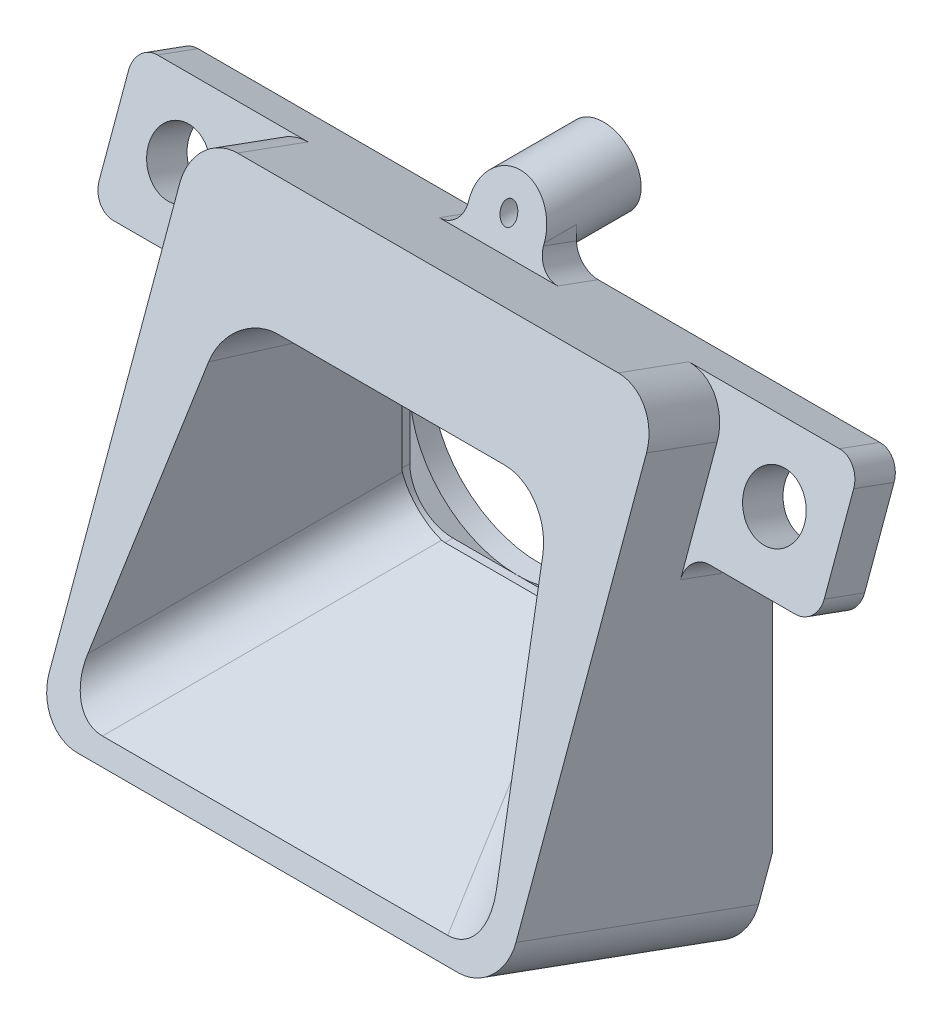
from build123d import *

# Parameters (mm, degrees)
BOSS_EXTRUDE1_DEPTH   = 12.6
SKETCH2_R             = 5.0000000000000036
CUT_EXTRUDE1_DEPTH    = 48.150424176246815
SKETCH3_W             = 10.00000000000001
SKETCH3_H             = 10.000000000000007
CUT_EXTRUDE2_DEPTH    = 11.6
CHAMFER1_SIZE         = 5
CHAMFER1_SIZE2        = 11.230183869521158
CUT_EXTRUDE3_DEPTH    = 48.150424176246815
BOSS_EXTRUDE2_DEPTH   = 40
SKETCH6_R             = 1.7500000000000004
SKETCH6_R_2           = 1.7500000000000002
BOSS_EXTRUDE3_DEPTH   = 3
CUT_EXTRUDE4_DEPTH    = 48.369406002186686
CUT_EXTRUDE5_DEPTH    = 47.07236166447865
BOSS_EXTRUDE4_DEPTH   = 6
SKETCH12_R            = 1.4000000000000001
CUT_EXTRUDE6_DEPTH    = 38.90502227131958
BOSS_EXTRUDE5_REACH   = 44.93
SKETCH14_W            = 3.5000000000000036
SKETCH14_H            = 3.265431857231029
CUT_EXTRUDE7_REACH    = 46.879
CUT_EXTRUDE8_REACH    = 46.879
M2_TAPPED_HOLE1_D     = 1.6
M2_TAPPED_HOLE1_DEPTH = 4.2
M2_TAPPED_HOLE1_TIP   = 0.48068849522204826
FILLET1_R             = 1
FILLET2_R             = 2
FILLET4_R             = 2


with BuildPart() as part:
    # Sketch1 → Boss-Extrude1 (new body)
    with BuildSketch(Plane.XY):
        Polygon((0, 0), (40, 0), (39.99999999999999, 21.550000000000004), (0, 21.550000000000004), align=None)
    extrude(amount=BOSS_EXTRUDE1_DEPTH)

    # Sketch2 → Cut-Extrude1 (cut, through all)
    with BuildSketch(Plane.XY.offset(12.6)):
        with Locations((19.999999999999996, 10.775000000000004)):
            Circle(SKETCH2_R)
    extrude(amount=-CUT_EXTRUDE1_DEPTH, mode=Mode.SUBTRACT)

    # Sketch3 → Cut-Extrude2 (cut)
    with BuildSketch(Plane.XY.offset(12.6)):
        with Locations((20, 10.775000000000002)):
            Rectangle(SKETCH3_W, SKETCH3_H)
    extrude(amount=-CUT_EXTRUDE2_DEPTH, mode=Mode.SUBTRACT)

    # Chamfer1
    chamfer1_edges = [part.edges().sort_by_distance(p)[0] for p in [
        (14.999999999999993, 10.775000000000002, 12.6),
        (19.999999999999996, 5.7749999999999995, 12.6),
        (25, 10.775000000000004, 12.6),
    ]]
    chamfer1_side = [part.faces().sort_by_distance(p)[0] for p in [
        (20, 0.45435696319083746, 12.6),
    ]]
    chamfer(chamfer1_edges, length=CHAMFER1_SIZE, length2=CHAMFER1_SIZE2, reference=chamfer1_side[0])

    # Sketch4 → Cut-Extrude3 (cut, through all)
    with BuildSketch(Plane.ZY):
        Polygon((12.6, 0), (5.164224911806891, 20.42962415095372), (0, 18.550000000000004), (0, 21.550000000000004), (12.6, 21.550000000000004), align=None)
    extrude(amount=-CUT_EXTRUDE3_DEPTH, mode=Mode.SUBTRACT)

    # Sketch5 → Boss-Extrude2 (add)
    with BuildSketch(Plane.ZY):
        Polygon((12.6, 0), (0, -4.5860249517541645), (0, 0), align=None)
    extrude(amount=-BOSS_EXTRUDE2_DEPTH)

    # Sketch6 → Boss-Extrude3 (add)
    with BuildSketch(Plane.XY.offset(-2.9999999999999996)):
        with Locations(Location((19.999999999999996, 20.275000000000002, 0), (0, 0, 260.303678946))):
            Circle(SKETCH6_R)
        with Locations(Location((20, 1.275000000000002, 0), (0, 0, 180))):
            Circle(SKETCH6_R_2)
    extrude(amount=BOSS_EXTRUDE3_DEPTH)

    # Sketch7 → Cut-Extrude4 (cut, through all)
    with BuildSketch(Plane(origin=(40, 1.288e-14, 0), x_dir=(0, 0, -1), z_dir=(1, 3.2e-16, 0))):
        Polygon((0, -4.586024951754178), (0, -0.47500000000000464), (-1.3212579510498954, -4.105126385784462), align=None)
    extrude(amount=-CUT_EXTRUDE4_DEPTH, mode=Mode.SUBTRACT)

    # Sketch8 → Cut-Extrude5 (cut, through all)
    with BuildSketch(Plane(origin=(0, 4.049561941025207, 11.126079991649561), x_dir=(1, 0, 0), z_dir=(0, 0.34202014332566943, 0.9396926207859082))):
        Polygon((0, 17.4312981155786), (9.149876173671583, 17.4312981155786), (9.149876173671586, -4.309453805903435), (0, -4.309453805903436), align=None)
        Polygon((40, -4.309453805903436), (30.850123826328417, -4.309453805903435), (30.850123826328417, 17.4312981155786), (40, 17.4312981155786), align=None)
    extrude(amount=-CUT_EXTRUDE5_DEPTH, mode=Mode.SUBTRACT)

    # Sketch11 → Boss-Extrude4 (add)
    with BuildSketch(Plane.ZY.offset(-9.149876173671585)):
        Polygon((4.8e-16, 18.550000000000008), (1.879385241571817, 19.234040286651346), (3.9315061015258332, 13.595884561935897), (2.0521208599540164, 12.911844275284558), align=None)
    boss_extrude4 = extrude(amount=BOSS_EXTRUDE4_DEPTH)

    # Sketch12 → Cut-Extrude6 (cut, through all)
    with BuildSketch(Plane(origin=(0, 2.8539780767228278, 7.841240321414484), x_dir=(1, 0, 0), z_dir=(0, 0.3420201433256694, 0.9396926207859083))):
        with Locations(Location((6.149876173671584, 14.431298115578603, 0), (0, 0, 270))):
            Circle(SKETCH12_R)
    cut_extrude6 = extrude(amount=-CUT_EXTRUDE6_DEPTH, mode=Mode.SUBTRACT)

    # Mirror1: Boss-Extrude4, Cut-Extrude6 across plane
    add(boss_extrude4.mirror(Plane.ZY.offset(-19.999999999999996)))
    add(cut_extrude6.mirror(Plane.ZY.offset(-19.999999999999996)), mode=Mode.SUBTRACT)

    # Boss-Extrude5: up to this plane
    boss_extrude5_end = Plane(origin=(0, 0, 0), z_dir=(0, 0, -1))
    # Sketch14 → Boss-Extrude5 (add, up to the surface)
    with BuildSketch(Plane(origin=(0, 2.8539780767228278, 7.841240321414484), x_dir=(1, 0, 0), z_dir=(0, 0.3420201433256694, 0.9396926207859083)), mode=Mode.PRIVATE) as boss_extrude5_sk1:
        with Locations((20, 19.064014044194117)):
            Rectangle(SKETCH14_W, SKETCH14_H)
    boss_extrude5_tool1 = split(extrude(boss_extrude5_sk1.sketch, amount=-BOSS_EXTRUDE5_REACH, mode=Mode.PRIVATE), bisect_by=boss_extrude5_end, keep=Keep.BOTH, mode=Mode.PRIVATE)
    add(boss_extrude5_tool1.solids().sort_by_distance((20, 20.768291, 1.320964))[0])

    # Cut-Extrude7: up to this plane
    cut_extrude7_end = Plane(origin=(0, 2.8539780767228256, 7.841240321414483), z_dir=(0, -0.3420201433256692, -0.9396926207859083))
    # Sketch15 → Cut-Extrude7 (cut, up to the surface)
    with BuildSketch(Plane(origin=(0, 0, 0), x_dir=(-1, 0, 0), z_dir=(0, 0, -1)), mode=Mode.PRIVATE) as cut_extrude7_sk1:
        with BuildLine():
            Line((-19.999999999999996, 22.025000000000006), (-21.75, 22.02500000000001))
            Line((-21.75, 22.02500000000001), (-21.750000000000004, 20.275000000000002))
            ThreePointArc((-21.750000000000004, 20.275000000000002), (-21.237436867076458, 21.512436867076463), (-19.999999999999996, 22.025000000000006))
        make_face()
    cut_extrude7_tool1 = split(extrude(cut_extrude7_sk1.sketch, amount=-CUT_EXTRUDE7_REACH, mode=Mode.PRIVATE), bisect_by=cut_extrude7_end, keep=Keep.BOTH, mode=Mode.PRIVATE)
    add(cut_extrude7_tool1.solids().sort_by_distance((21.359106, 21.634106, 0))[0], mode=Mode.SUBTRACT)

    # Cut-Extrude8: up to this plane
    cut_extrude8_end = Plane(origin=(0, 2.8539780767228256, 7.841240321414483), z_dir=(0, -0.3420201433256692, -0.9396926207859083))
    # Sketch16 → Cut-Extrude8 (cut, up to the surface)
    with BuildSketch(Plane(origin=(0, 0, 0), x_dir=(-1, 0, 0), z_dir=(0, 0, -1)), mode=Mode.PRIVATE) as cut_extrude8_sk1:
        with BuildLine():
            Line((-18.249999999999993, 20.275000000000002), (-18.249999999999996, 22.02500000000001))
            Line((-18.249999999999996, 22.02500000000001), (-19.999999999999996, 22.025000000000006))
            ThreePointArc((-19.999999999999996, 22.025000000000006), (-18.762563132923535, 21.512436867076463), (-18.249999999999993, 20.275000000000002))
        make_face()
    cut_extrude8_tool1 = split(extrude(cut_extrude8_sk1.sketch, amount=-CUT_EXTRUDE8_REACH, mode=Mode.PRIVATE), bisect_by=cut_extrude8_end, keep=Keep.BOTH, mode=Mode.PRIVATE)
    add(cut_extrude8_tool1.solids().sort_by_distance((18.640894, 21.634106, 0))[0], mode=Mode.SUBTRACT)


with BuildPart() as body_2:
    # of the pieces the cut leaves, the one that is kept (cut_extrude8_keep)
    add(part.part.solids().sort_by_distance((30.850123826, -0.475, 0))[0])

    # M2 Tapped Hole1
    with Locations(Plane(origin=(20, 20.275, -3), x_dir=(-1, 0, 0), z_dir=(0, 0, -1))):
        with Locations((0, 0), (0, -19)):
            Hole(M2_TAPPED_HOLE1_D / 2, depth=M2_TAPPED_HOLE1_DEPTH)
            with Locations((0, 0, -(M2_TAPPED_HOLE1_DEPTH + M2_TAPPED_HOLE1_TIP / 2))):  # 118° drill point
                Cone(0, M2_TAPPED_HOLE1_D / 2, M2_TAPPED_HOLE1_TIP, mode=Mode.SUBTRACT)

    # Fillet1
    fillet1_edges = [body_2.edges().sort_by_distance(p)[0] for p in [
        (18.249999999999996, 18.89202014332568, 0.9396926207859103),
        (21.75, 18.89202014332568, 0.9396926207859103),
        (36.85012382632841, 18.892020143325677, 0.9396926207859077),
        (30.850123826328407, 13.253864418610231, 2.9918134807399235),
        (9.149876173671583, 13.25386441861023, 2.9918134807399244),
        (3.149876173671583, 13.253864418610227, 2.991813480739925),
        (3.149876173671582, 18.892020143325677, 0.9396926207859085),
        (36.85012382632841, 13.253864418610231, 2.991813480739924),
    ]]
    fillet(fillet1_edges, radius=FILLET1_R)

    # Fillet2
    fillet2_edges = [body_2.edges().sort_by_distance(p)[0] for p in [
        (9.149876173671586, -2.052563192892223, 6.960628975524948),
        (9.149876173671583, 19.831832218802536, 3.521805076689357),
        (30.850123826328417, -2.0525631928922223, 6.9606289755249495),
        (30.850123826328417, 19.831832218802536, 3.5218050766893576),
    ]]
    fillet(fillet2_edges, radius=FILLET2_R)

    # Fillet4
    fillet4_edges = [body_2.edges().sort_by_distance(p)[0] for p in [
        (26.22183071260031, 15.775000000000007, 4.114092842464741),
    ]]
    fillet(fillet4_edges, radius=FILLET4_R)
    fillet4_2_edges = [body_2.edges().sort_by_distance(p)[0] for p in [
        (13.778169287399688, 15.775000000000006, 4.114092842464743),
    ]]
    fillet(fillet4_2_edges, radius=FILLET4_R)
    fillet4_3_edges = [body_2.edges().sort_by_distance(p)[0] for p in [
        (14.999999999999993, 15.775000000000007, 1.184908065239421),
    ]]
    fillet(fillet4_3_edges, radius=FILLET4_R)
    fillet4_4_edges = [body_2.edges().sort_by_distance(p)[0] for p in [
        (25, 15.775000000000007, 1.184908065239421),
    ]]
    fillet(fillet4_4_edges, radius=FILLET4_R)
    fillet4_5_edges = [body_2.edges().sort_by_distance(p)[0] for p in [
        (12.574938086835799, 3.3499380868358024, 6.81659436644018),
    ]]
    fillet(fillet4_5_edges, radius=FILLET4_R)
    fillet4_6_edges = [body_2.edges().sort_by_distance(p)[0] for p in [
        (27.425061913164196, 3.349938086835803, 6.816594366440178),
    ]]
    fillet(fillet4_6_edges, radius=FILLET4_R)
    fillet4_7_edges = [body_2.edges().sort_by_distance(p)[0] for p in [
        (25, 5.7749999999999995, 1.7667114299152384),
    ]]
    fillet(fillet4_7_edges, radius=FILLET4_R)
    fillet4_8_edges = [body_2.edges().sort_by_distance(p)[0] for p in [
        (14.999999999999993, 5.7749999999999995, 1.766711429915226),
    ]]
    fillet(fillet4_8_edges, radius=FILLET4_R)


solid = body_2.part
